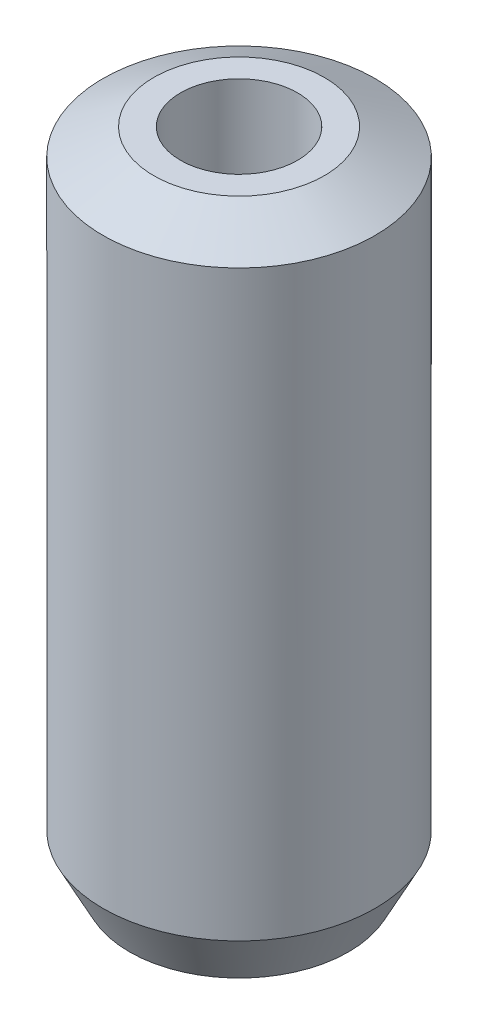
from build123d import *
from OCP.BRepFilletAPI import BRepFilletAPI_MakeChamfer

# Parameters (mm, degrees)
SKETCH1_R           = 15
BOSS_EXTRUDE1_DEPTH = 72.782154017
SKETCH2_R           = 6.455908715
CUT_EXTRUDE1_DEPTH  = 76.810566172
CHAMFER1_SIZE       = 2.905080528
CHAMFER1_SIZE2      = 5.598519787


with BuildPart() as part:
    # Sketch1 → Boss-Extrude1 (new body)
    with BuildSketch(Plane(origin=(0, 0, 0), x_dir=(1, 0, 0), z_dir=(0, 1, 0))):
        Circle(SKETCH1_R)
    extrude(amount=BOSS_EXTRUDE1_DEPTH)

    # Sketch2 → Cut-Extrude1 (cut, through all)
    with BuildSketch(Plane(origin=(0, 0, 0), x_dir=(1, 0, 0), z_dir=(0, 1, 0))):
        Circle(SKETCH2_R)
    extrude(amount=CUT_EXTRUDE1_DEPTH, mode=Mode.SUBTRACT)

    # Chamfer1: one chamfer whose edges measure the first distance from different faces: ONE call of the kernel's chamfer builder (chamfer() names one face for all edges)
    chamfer1_edges_1 = [part.edges().sort_by_distance(p)[0] for p in [
        (-15, 72.782154017, 0),
    ]]
    chamfer1_side_1 = [part.faces().sort_by_distance(p)[0] for p in [
        (-15, 36.391077008, 0),
    ]]
    chamfer1_edges_2 = [part.edges().sort_by_distance(p)[0] for p in [
        (-15, 0, 0),
    ]]
    chamfer1_side_2 = [part.faces().sort_by_distance(p)[0] for p in [
        (-14.575735931, 0, 0),
    ]]
    chamfer1 = BRepFilletAPI_MakeChamfer(part.part.solid().wrapped)
    for e in chamfer1_edges_1:
        chamfer1.Add(CHAMFER1_SIZE, CHAMFER1_SIZE2, e.wrapped, chamfer1_side_1[0].wrapped)  # the first distance lies on this face
    for e in chamfer1_edges_2:
        chamfer1.Add(CHAMFER1_SIZE, CHAMFER1_SIZE2, e.wrapped, chamfer1_side_2[0].wrapped)  # the first distance lies on this face
    add(Compound.cast(chamfer1.Shape()), mode=Mode.REPLACE)


solid = part.part
